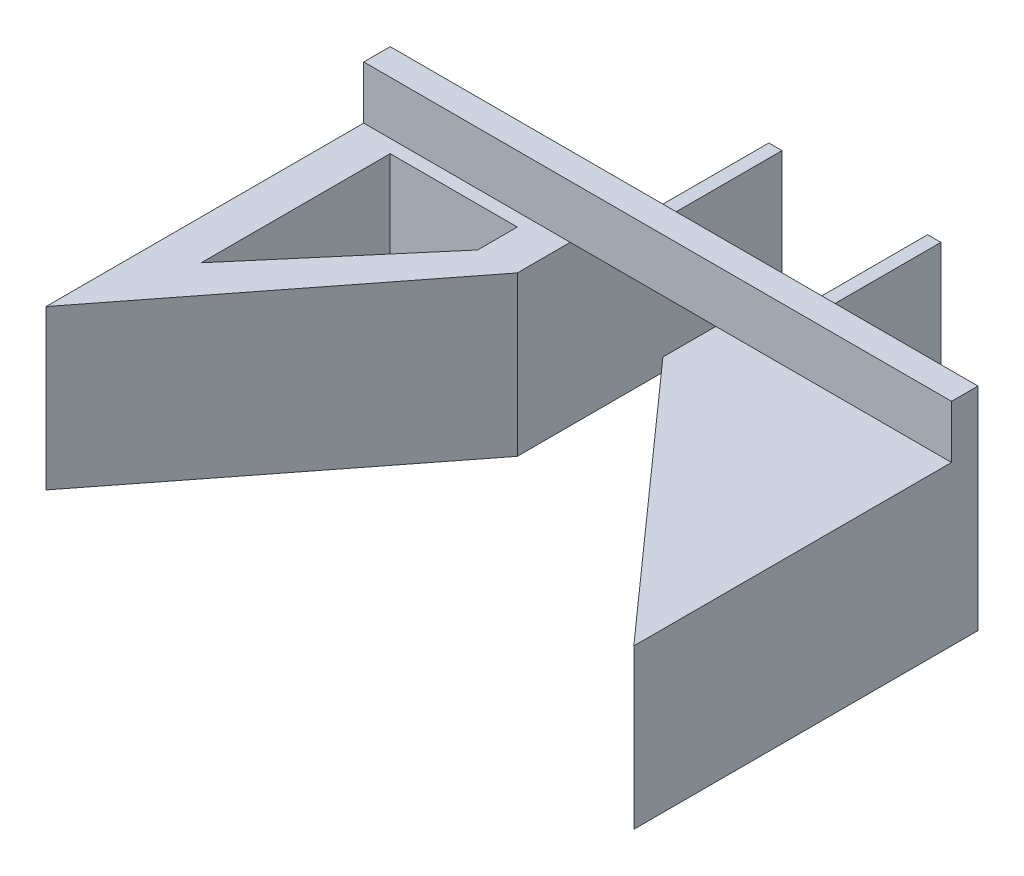
from build123d import *

# Parameters (mm, degrees)
BOSS_EXTRUDE1_DEPTH   = 60
BOSS_EXTRUDE1_2_DEPTH = 60
SKETCH3_W             = 222
SKETCH3_H             = 10
BOSS_EXTRUDE3_DEPTH   = 20
SKETCH4_W             = 5
SKETCH4_H             = 70
BOSS_EXTRUDE4_DEPTH   = 50
SKETCH5_W             = 5
SKETCH5_H             = 70
BOSS_EXTRUDE5_DEPTH   = 50


with BuildPart() as part:
    # Sketch1 → Boss-Extrude1 (new body)
    with BuildSketch(Plane(origin=(0, 0, 0), x_dir=(1, 0, 0), z_dir=(0, 1, 0))):
        Polygon((0, 42.700803213), (0, 27.700803213), (0, 12.700803213), (89, -87.299196787), (89, 42.700803213), align=None)
    extrude(amount=BOSS_EXTRUDE1_DEPTH)



with BuildPart() as body_2:
    # Sketch1 → Boss-Extrude1 2 (new body)
    with BuildSketch(Plane(origin=(0, 0, 0), x_dir=(1, 0, 0), z_dir=(0, 1, 0))):
        Polygon((-133, 12.700803213), (-133, -87.299196787), (-55, 12.700803213), (-55, 42.700803213), (-133, 42.700803213), align=None)
        Polygon((-118, 27.700803213), (-118, -43.679444691), (-70, 12.700803213), (-70, 27.700803213), align=None, mode=Mode.SUBTRACT)
    extrude(amount=BOSS_EXTRUDE1_2_DEPTH)

    # Sketch3 → Boss-Extrude3 (add)
    with BuildSketch(Plane(origin=(0, 60, 0), x_dir=(1, 0, 0), z_dir=(0, 1, 0))):
        with Locations((-22, 37.700803213)):
            Rectangle(SKETCH3_W, SKETCH3_H)
    extrude(amount=BOSS_EXTRUDE3_DEPTH)

    # Sketch4 → Boss-Extrude4 (add)
    with BuildSketch(Plane(origin=(0, 0, 0), x_dir=(-1, 0, 0), z_dir=(0, -1, 0))):
        with Locations((57.5, 77.700803213)):
            Rectangle(SKETCH4_W, SKETCH4_H)
    extrude(amount=-BOSS_EXTRUDE4_DEPTH)


with BuildPart() as part_1:
    add(part.part)

    add(body_2.part)  # Boss-Extrude5 merges body 2
    # Sketch5 → Boss-Extrude5 (add)
    with BuildSketch(Plane(origin=(0, 0, 0), x_dir=(-1, 0, 0), z_dir=(0, -1, 0))):
        with Locations((-2.5, 77.700803213)):
            Rectangle(SKETCH5_W, SKETCH5_H)
    extrude(amount=-BOSS_EXTRUDE5_DEPTH)


solid = part_1.part
